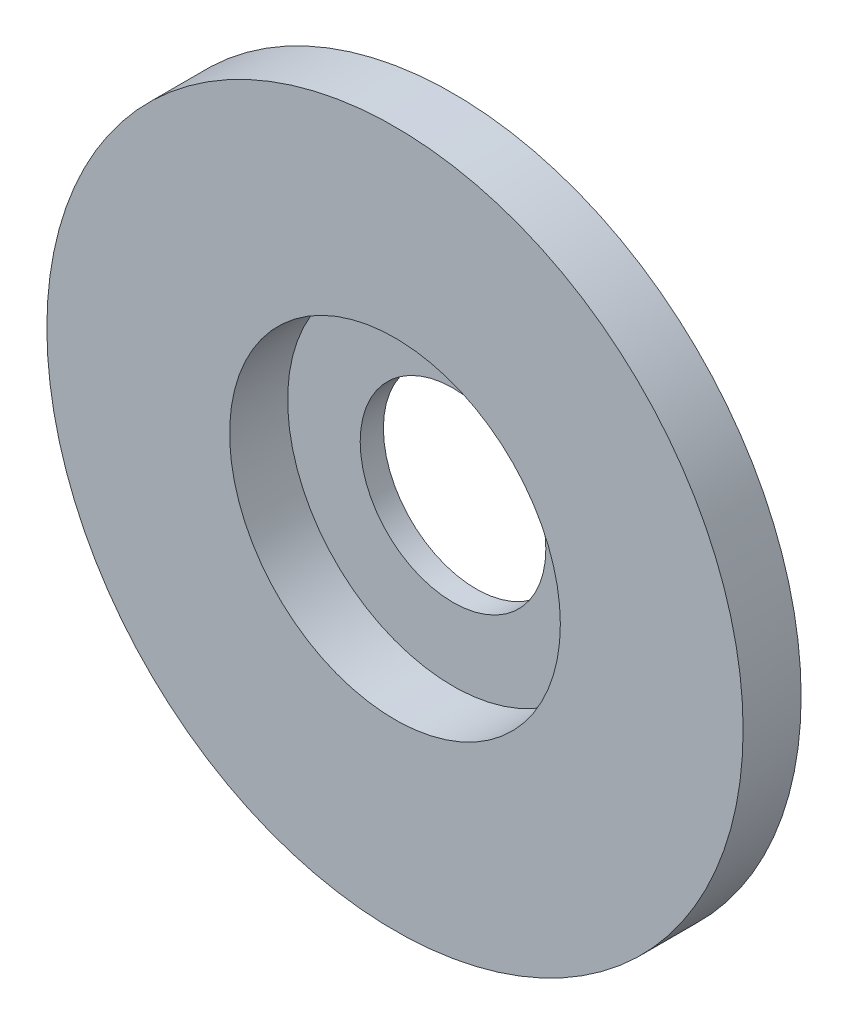
from build123d import *
from build123d.topology import SkipClean

# Parameters (mm, degrees)
SKETCH2_R           = 30
SKETCH2_R_2         = 8
BOSS_EXTRUDE1_DEPTH = 2
SKETCH3_R           = 30
SKETCH3_R_2         = 14.25
BOSS_EXTRUDE2_DEPTH = 5
CUT_EXTRUDE1_START  = -1
SKETCH5_R           = 14.25
SKETCH5_R_2         = 8
CUT_EXTRUDE1_DEPTH  = 1
SKETCH7_R           = 30
SKETCH7_R_2         = 14.25
BOSS_EXTRUDE4_DEPTH = 1
CUT_EXTRUDE3_START  = -2
SKETCH8_R           = 30
SKETCH8_R_2         = 14.25
CUT_EXTRUDE3_DEPTH  = 2
BOSS_EXTRUDE6_START = 1
SKETCH10_R          = 20
SKETCH10_R_2        = 8
BOSS_EXTRUDE6_DEPTH = 1
SKETCH11_R          = 30
SKETCH11_R_2        = 20
CUT_EXTRUDE4_DEPTH  = 1


with BuildPart() as part:
    # Sketch2 → Boss-Extrude1 (new body)
    with BuildSketch(Plane.XY):
        Circle(SKETCH2_R)
        Circle(SKETCH2_R_2, mode=Mode.SUBTRACT)
    extrude(amount=BOSS_EXTRUDE1_DEPTH)

    # Sketch3 → Boss-Extrude2 (add)
    with BuildSketch(Plane.XY.offset(2)):
        Circle(SKETCH3_R)
        Circle(SKETCH3_R_2, mode=Mode.SUBTRACT)
    extrude(amount=BOSS_EXTRUDE2_DEPTH)

    # Sketch5 → Cut-Extrude1 (cut)
    with BuildSketch(Plane.XY.offset(2).offset(CUT_EXTRUDE1_START)):
        Circle(SKETCH5_R)
        Circle(SKETCH5_R_2, mode=Mode.SUBTRACT)
    extrude(amount=CUT_EXTRUDE1_DEPTH, mode=Mode.SUBTRACT)

    # Sketch7 → Boss-Extrude4 (add)
    with BuildSketch(Plane.XY.offset(7)):
        Circle(SKETCH7_R)
        Circle(SKETCH7_R_2, mode=Mode.SUBTRACT)
    extrude(amount=BOSS_EXTRUDE4_DEPTH)

    # Sketch8 → Cut-Extrude3 (cut)
    with BuildSketch(Plane.XY.offset(8).offset(CUT_EXTRUDE3_START)):
        Circle(SKETCH8_R)
        Circle(SKETCH8_R_2, mode=Mode.SUBTRACT)
    extrude(amount=CUT_EXTRUDE3_DEPTH, mode=Mode.SUBTRACT)

    # Sketch10 → Boss-Extrude6 (add)
    with SkipClean():  # the faces are left unmerged after this step: merging them gives an invalid solid
        with BuildSketch(Plane(origin=(0, 0, 0), x_dir=(-1, 0, 0), z_dir=(0, 0, -1)).offset(BOSS_EXTRUDE6_START)):
            Circle(SKETCH10_R)
            Circle(SKETCH10_R_2, mode=Mode.SUBTRACT)
        extrude(amount=-BOSS_EXTRUDE6_DEPTH)

    # Sketch11 → Cut-Extrude4 (cut)
    with SkipClean():  # the faces are left unmerged after this step: merging them gives an invalid solid
        with BuildSketch(Plane(origin=(0, 0, 0), x_dir=(-1, 0, 0), z_dir=(0, 0, -1))):
            Circle(SKETCH11_R)
            Circle(SKETCH11_R_2, mode=Mode.SUBTRACT)
        extrude(amount=-CUT_EXTRUDE4_DEPTH, mode=Mode.SUBTRACT)


solid = part.part
